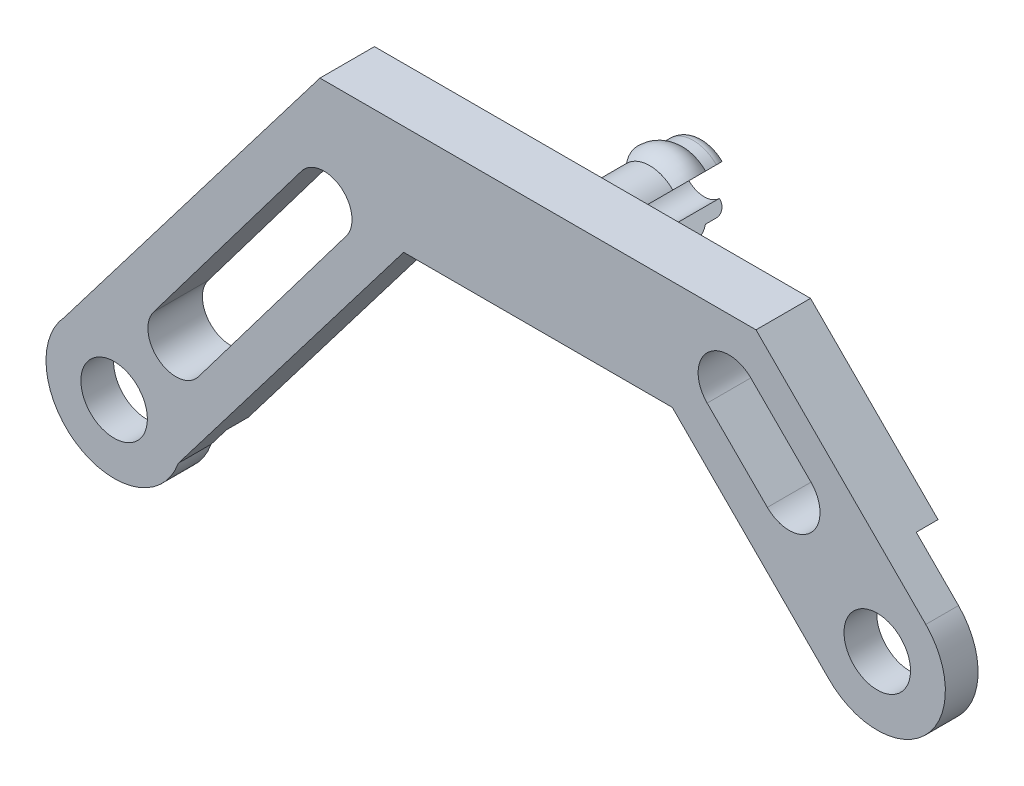
from build123d import *

# Parameters (mm, degrees)
SZKIC1_R                    = 3.05
DODANIE_WYCI_GNI_CIE1_DEPTH = 5
WYTNIJ_WYCI_GNI_CIE2_DEPTH  = 10
WYTNIJ_WYCI_GNI_CIE4_DEPTH  = 10
DODANIE_WYCI_GNI_CIE2_DEPTH = 5.25
OBR_T1_ANGLE                = 90
OBR_T2_ANGLE                = 90
SZKIC8_W                    = 100.07426583
SZKIC8_H                    = 50.963746487
WYTNIJ_WYCI_GNI_CIE5_DEPTH  = 23
WYTNIJ_WYCI_GNI_CIE6_DEPTH  = 2
WYTNIJ_WYCI_GNI_CIE7_DEPTH  = 2
WYTNIJ_WYCI_GNI_CIE9_DEPTH  = 5.25
ZAOKR_GLENIE2_R             = 1


# Read off the part's stored shape, not the designer's step: Obrót1, Obrót2
with BuildPart() as part:
    # Szkic1 → Dodanie-wyciągnięcie1 (new body)
    with BuildSketch(Plane.XY):
        with BuildLine():
            Line((-20, 0), (20, 0))
            Line((20, 0), (35.574751144, -15.6155831))
            ThreePointArc((35.574751144, -15.6155831), (35.476976606, -24.481579544), (26.61176868, -24.328148016))
            Line((26.61176868, -24.328148016), (12.321086207, -10))
            Line((12.321086207, -10), (-12.321086207, -10))
            Line((-12.321086207, -10), (-32.989436275, -37.090675759))
            ThreePointArc((-32.989436275, -37.090675759), (-42.12272692, -40.342590816), (-43.451924108, -30.739196396))
            Line((-43.451924108, -30.739196396), (-20, 0))
        make_face()
        with Locations((-38.879391697, -35)):
            Circle(SZKIC1_R, mode=Mode.SUBTRACT)
        with Locations((31.120608303, -20)):
            Circle(SZKIC1_R, mode=Mode.SUBTRACT)
    dodanie_wyci_gni_cie1 = extrude(amount=DODANIE_WYCI_GNI_CIE1_DEPTH)

    # Szkic3 → Wytnij-wyciągnięcie2 (cut)
    with BuildSketch(Plane(origin=(0, 0, 0), x_dir=(-1, 0, 0), z_dir=(0, 0, -1))):
        with BuildLine():
            Line((21.683047095, -8.225427037), (35.260679995, -26.209046772))
            ThreePointArc((35.260679995, -26.209046772), (34.75757763, -29.812902485), (31.153721917, -29.309800121))
            Line((31.153721917, -29.309800121), (17.576089017, -11.326180386))
            ThreePointArc((17.576089017, -11.326180386), (18.079191382, -7.722324673), (21.683047095, -8.225427037))
        make_face()
    wytnij_wyci_gni_cie2 = extrude(amount=-WYTNIJ_WYCI_GNI_CIE2_DEPTH, mode=Mode.SUBTRACT)

    # Szkic4 → Wytnij-wyciągnięcie4 (cut)
    with BuildSketch(Plane(origin=(0, 0, 0), x_dir=(-1, 0, 0), z_dir=(0, 0, -1))):
        with BuildLine():
            Line((-15.517695436, -8.06176207), (-21.039997823, -13.584064457))
            ThreePointArc((-21.039997823, -13.584064457), (-25.043667053, -13.584064457), (-25.043667053, -9.580395227))
            Line((-25.043667053, -9.580395227), (-19.521364667, -4.05809284))
            ThreePointArc((-19.521364667, -4.05809284), (-15.517695436, -4.05809284), (-15.517695436, -8.06176207))
        make_face()
    wytnij_wyci_gni_cie4 = extrude(amount=-WYTNIJ_WYCI_GNI_CIE4_DEPTH, mode=Mode.SUBTRACT)

    # Szkic5 → Dodanie-wyciągnięcie2 (add)
    with BuildSketch(Plane.XY.offset(5)):
        with BuildLine():
            Line((-1.922496946, -4.528242282), (-2.878604971, -4.259692233))
            ThreePointArc((-2.878604971, -4.259692233), (0, -2.078230062), (2.878604971, -4.259692233))
            Line((2.878604971, -4.259692233), (1.925488275, -4.527402083))
            ThreePointArc((1.925488275, -4.527402083), (0.001178609, -3.075757991), (-1.922496946, -4.528242282))
        make_face()
        with BuildLine():
            Line((-1.925488275, -5.609058042), (-2.878604971, -5.876767892))
            ThreePointArc((-2.878604971, -5.876767892), (0, -8.058230062), (2.878604971, -5.876767892))
            Line((2.878604971, -5.876767892), (1.925488275, -5.609058042))
            ThreePointArc((1.925488275, -5.609058042), (0, -7.068230062), (-1.925488275, -5.609058042))
        make_face()
    dodanie_wyci_gni_cie2 = extrude(amount=DODANIE_WYCI_GNI_CIE2_DEPTH)

    # Obrót1 outline → Obrót1 (revolve)
    with BuildSketch(Plane(origin=(0, -5.076440198, 0), x_dir=(0.7071067811865502, 0.7071067811865448, 0), z_dir=(0.7071067811865448, -0.7071067811865502, 0))):
        with BuildLine():
            ThreePointArc((2.998210136, 10.25), (3.619530479, 11.75), (2.998210136, 13.25))
            Line((2.998210136, 13.25), (2.998210136, 15.25))
            Line((2.998210136, 15.25), (1.907479051, 15.25))
            Line((1.907479051, 15.25), (1.907479051, 10.25))
            Line((1.907479051, 10.25), (2.998210136, 10.25))
        make_face()
    obr_t1 = revolve(axis=Axis((0, -5.076440198, 0), (0, 0, 1)), revolution_arc=OBR_T1_ANGLE)

    # Obrót2 outline → Obrót2 (revolve)
    with BuildSketch(Plane(origin=(0, -5.076440198, 0), x_dir=(-0.7071067811865493, -0.7071067811865457, 0), z_dir=(-0.7071067811865457, 0.7071067811865493, 0))):
        with BuildLine():
            Line((1.981789864, 15.25), (1.981789864, 10.25))
            Line((1.981789864, 10.25), (2.981789864, 10.25))
            ThreePointArc((2.981789864, 10.25), (3.603110208, 11.75), (2.981789864, 13.25))
            Line((2.981789864, 13.25), (2.981789864, 15.25))
            Line((2.981789864, 15.25), (1.981789864, 15.25))
        make_face()
    obr_t2 = revolve(axis=Axis((0, -5.076440198, 0), (0, 0, 1)), revolution_arc=OBR_T2_ANGLE)

    # Lustro4: Dodanie-wyciągnięcie1, Wytnij-wyciągnięcie2, Wytnij-wyciągnięcie4, Dodanie-wyciągnięcie2, Obrót1, Obrót2 across plane
    add(dodanie_wyci_gni_cie1.mirror(Plane(origin=(-38.879391697, -35, 0), x_dir=(1, 0, 0), z_dir=(0, 0, 1))))
    add(wytnij_wyci_gni_cie2.mirror(Plane(origin=(-38.879391697, -35, 0), x_dir=(1, 0, 0), z_dir=(0, 0, 1))), mode=Mode.SUBTRACT)
    add(wytnij_wyci_gni_cie4.mirror(Plane(origin=(-38.879391697, -35, 0), x_dir=(1, 0, 0), z_dir=(0, 0, 1))), mode=Mode.SUBTRACT)
    add(dodanie_wyci_gni_cie2.mirror(Plane(origin=(-38.879391697, -35, 0), x_dir=(1, 0, 0), z_dir=(0, 0, 1))))
    add(obr_t1.mirror(Plane(origin=(-38.879391697, -35, 0), x_dir=(1, 0, 0), z_dir=(0, 0, 1))))
    add(obr_t2.mirror(Plane(origin=(-38.879391697, -35, 0), x_dir=(1, 0, 0), z_dir=(0, 0, 1))))

    # Szkic8 → Wytnij-wyciągnięcie5 (cut)
    with BuildSketch(Plane.XY):
        with Locations((-3.506949348, -18.717463345)):
            Rectangle(SZKIC8_W, SZKIC8_H)
    extrude(amount=WYTNIJ_WYCI_GNI_CIE5_DEPTH, mode=Mode.SUBTRACT)

    # Szkic9 → Wytnij-wyciągnięcie6 (cut)
    with BuildSketch(Plane.XY.offset(-5)):
        Polygon((33.793576108, -9.633416266), (20.924371092, -22.502621281), (34.229820345, -35.808070534), (47.099025361, -22.938865519), align=None)
    extrude(amount=WYTNIJ_WYCI_GNI_CIE6_DEPTH, mode=Mode.SUBTRACT)

    # Szkic10 → Wytnij-wyciągnięcie7 (cut)
    with BuildSketch(Plane.XY.offset(-5)):
        Polygon((-30.537850877, -36.007651395), (-42.082921385, -27.199544837), (-48.802909893, -36.007651395), (-37.257839386, -44.815757953), align=None)
    extrude(amount=WYTNIJ_WYCI_GNI_CIE7_DEPTH, mode=Mode.SUBTRACT)

    # Szkic14 → Wytnij-wyciągnięcie9 (cut)
    with BuildSketch(Plane(origin=(0, 0, -10.25), x_dir=(-1, 0, 0), z_dir=(0, 0, -1))):
        with BuildLine():
            Line((-2.559394547, -2.517045651), (-1.348791372, -3.727648826))
            Line((-1.348791372, -3.727648826), (1.348791372, -3.727648826))
            Line((1.348791372, -3.727648826), (2.559394547, -2.517045651))
            ThreePointArc((2.559394547, -2.517045651), (3.408337444, -5.072577978), (2.547783661, -7.624223859))
            Line((2.547783661, -7.624223859), (1.410102537, -6.486542735))
            Line((1.410102537, -6.486542735), (-1.410102537, -6.486542735))
            Line((-1.410102537, -6.486542735), (-2.547783661, -7.624223859))
            ThreePointArc((-2.547783661, -7.624223859), (-3.611320344, -5.073039448), (-2.559394547, -2.517045651))
        make_face()
    extrude(amount=-WYTNIJ_WYCI_GNI_CIE9_DEPTH, mode=Mode.SUBTRACT)

    # Zaokrąglenie2
    zaokr_glenie2_edges = [part.edges().sort_by_distance(p)[0] for p in [
        (0, -2.078230062, -15.25),
        (0, -8.058230062, -15.25),
    ]]
    fillet(zaokr_glenie2_edges, radius=ZAOKR_GLENIE2_R - 0.0001)  # a hair under: the kernel refuses the full size


solid = part.part
